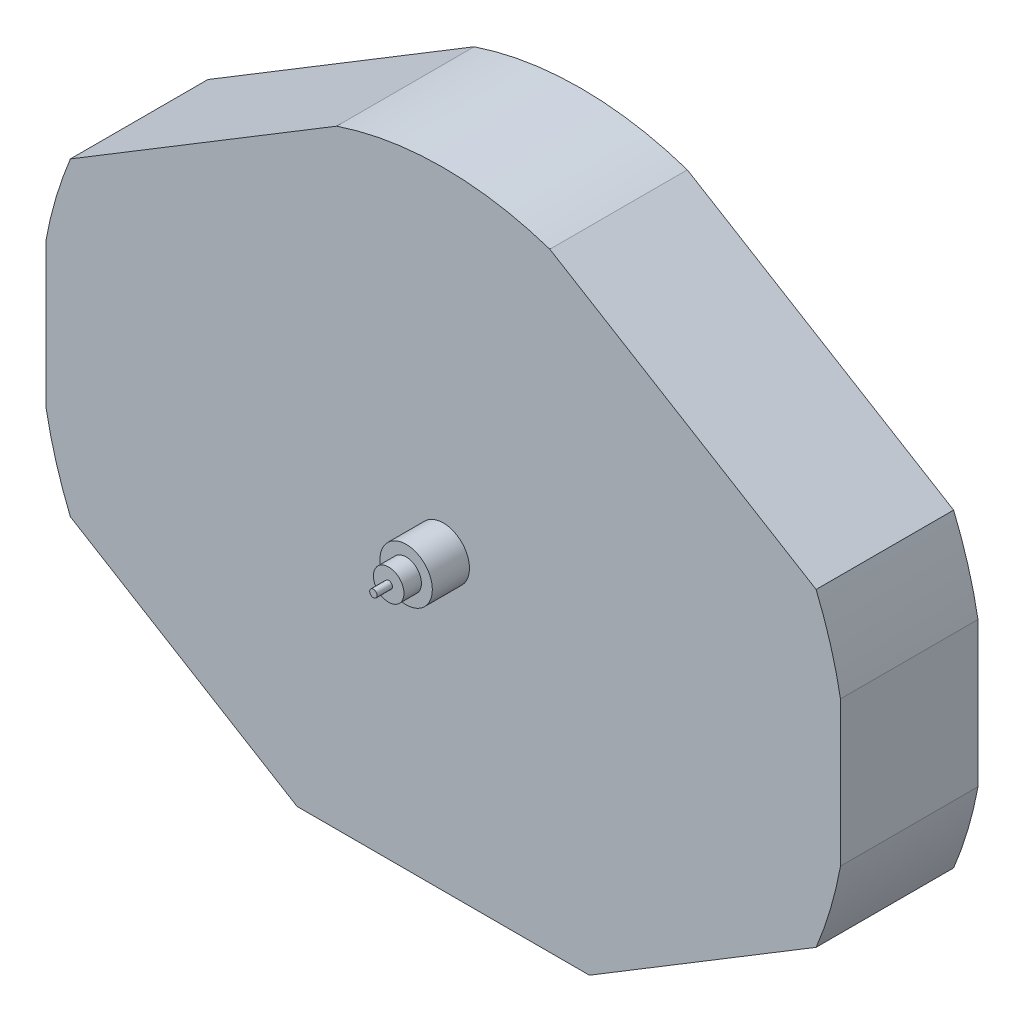
from build123d import *

# Parameters (mm, degrees)
BOSS_EXTRU_1_DEPTH = 3.15
ESQUISSE4_R        = 0.6
BOSS_EXTRU_2_DEPTH = 0.85
ESQUISSE5_R        = 0.35
BOSS_EXTRU_3_DEPTH = 0.4
ESQUISSE6_R        = 0.085
BOSS_EXTRU_4_DEPTH = 0.35


with BuildPart() as part:
    # Esquisse2 → Boss.-Extru.1 (new body)
    with BuildSketch(Plane.XY):
        with BuildLine():
            Line((9.1, 1.659066002), (9.1, -1.659066002))
            ThreePointArc((9.1, -1.659066002), (8.871356868, -2.619451721), (8.541662602, -3.55))
            Line((8.541662602, -3.55), (3.348120127, -6.7))
            Line((3.348120127, -6.7), (-3.348120127, -6.7))
            Line((-3.348120127, -6.7), (-8.541662602, -3.55))
            ThreePointArc((-8.541662602, -3.55), (-8.871356868, -2.619451721), (-9.1, -1.659066002))
            Line((-9.1, -1.659066002), (-9.1, 1.659066002))
            ThreePointArc((-9.1, 1.659066002), (-8.871356868, 2.619451721), (-8.541662602, 3.55))
            Line((-8.541662602, 3.55), (-2.441311123, 7.25))
            ThreePointArc((-2.441311123, 7.25), (0, 7.65), (2.441311123, 7.25))
            Line((2.441311123, 7.25), (8.541662602, 3.55))
            ThreePointArc((8.541662602, 3.55), (8.871356868, 2.619451721), (9.1, 1.659066002))
        make_face()
    extrude(amount=BOSS_EXTRU_1_DEPTH)

    # Esquisse4 → Boss.-Extru.2 (add)
    with BuildSketch(Plane.XY.offset(3.15)):
        Circle(ESQUISSE4_R)
    extrude(amount=BOSS_EXTRU_2_DEPTH)

    # Esquisse5 → Boss.-Extru.3 (add)
    with BuildSketch(Plane.XY.offset(4)):
        Circle(ESQUISSE5_R)
    extrude(amount=BOSS_EXTRU_3_DEPTH)

    # Esquisse6 → Boss.-Extru.4 (add)
    with BuildSketch(Plane.XY.offset(4.4)):
        Circle(ESQUISSE6_R)
    extrude(amount=BOSS_EXTRU_4_DEPTH)


solid = part.part
